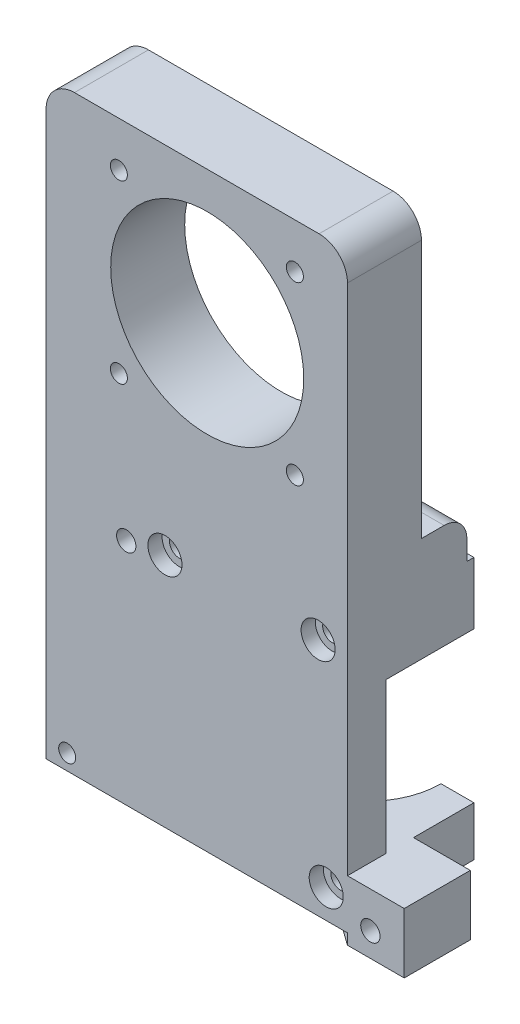
from build123d import *
from OCP.BRepAlgoAPI import BRepAlgoAPI_Cut
from OCP.TopTools import TopTools_ListOfShape

# Parameters (mm, degrees)
SKETCH1_W                     = 45
SKETCH1_H                     = 45
BOSS_EXTRUDE1_DEPTH           = 35
SKETCH2_R                     = 13
CUT_EXTRUDE3_DEPTH            = 35
SKETCH4_R                     = 1.7
CUT_EXTRUDE8_DEPTH            = 35
SKETCH7_R                     = 1.7
CUT_EXTRUDE9_DEPTH            = 35
SKETCH6_R                     = 1.7
CUT_EXTRUDE10_DEPTH           = 35
SKETCH5_R                     = 1.7
CUT_EXTRUDE11_DEPTH           = 35
CUT_EXTRUDE12_DEPTH           = 12
BOSS_EXTRUDE4_DEPTH           = 2
BOSS_EXTRUDE4_DEPTH_BACK      = 37.5
SKETCH14_W                    = 6
SKETCH14_H                    = 6
CUT_EXTRUDE17_START           = -7
SKETCH20_R                    = 2.2
CUT_EXTRUDE17_DEPTH           = 70.77141069
SKETCH21_R                    = 1.75
CUT_EXTRUDE18_DEPTH           = 2
BOSS_EXTRUDE5_DEPTH           = 44.571207257
BOSS_EXTRUDE5_DEPTH_BACK      = 1.562633388
SKETCH22_W                    = 53.082637552
SKETCH22_H                    = 40.002520942
SKETCH23_W                    = 29.449729346
SKETCH23_H                    = 26.517519529
CUT_EXTRUDE19_DEPTH           = 95.427299018
SKETCH25_R                    = 5
CUT_EXTRUDE24_DEPTH           = 2.6
SKETCH26_R                    = 8.1
CUT_EXTRUDE25_DEPTH           = 4
SKETCH27_R                    = 6.7
CUT_EXTRUDE28_DEPTH           = 6
SKETCH30_R                    = 13
CUT_EXTRUDE30_DEPTH           = 10.767560088
SKETCH31_W                    = 19.349450051
SKETCH31_H                    = 23.644133728
CUT_EXTRUDE31_DEPTH           = 9.664293754
SKETCH34_R                    = 1.5
CUT_EXTRUDE32_DEPTH           = 9
SKETCH37_W                    = 11.635024897
SKETCH37_H                    = 10.599921236
BOSS_EXTRUDE6_DEPTH           = 10
BOSS_EXTRUDE6_OTHER_WAY_DEPTH = 5
BOSS_EXTRUDE6_OTHER_WAY_TAPER = 29
SKETCH38_R                    = 1.700000001
CUT_EXTRUDE33_DEPTH           = 10
SKETCH39_R                    = 1.700000001
CUT_EXTRUDE34_DEPTH           = 88.0662855
SKETCH40_W                    = 17.159872711
SKETCH40_H                    = 13
BOSS_EXTRUDE7_DEPTH           = 16
SKETCH41_R                    = 4.5
CUT_EXTRUDE35_DEPTH           = 15
SKETCH42_W                    = 9.331425876
SKETCH42_H                    = 3
CUT_EXTRUDE36_DEPTH           = 15
CUT_EXTRUDE37_DEPTH           = 5
SKETCH44_R                    = 1.7
CUT_EXTRUDE38_DEPTH           = 23
CUT_EXTRUDE39_DEPTH           = 5
CUT_EXTRUDE40_DEPTH           = 5
CUT_EXTRUDE41_DEPTH           = 5
SKETCH53_R                    = 1.7
CUT_EXTRUDE42_DEPTH           = 90.646740997
SKETCH52_R                    = 1.7
CUT_EXTRUDE43_DEPTH           = 90.646740997
SKETCH51_R                    = 1.7
CUT_EXTRUDE44_DEPTH           = 90.646740997
CUT_EXTRUDE46_DEPTH           = 5
SKETCH57_R                    = 3
CUT_EXTRUDE48_DEPTH           = 2.5
SKETCH58_R                    = 3
CUT_EXTRUDE49_DEPTH           = 2.5
SKETCH59_R                    = 3
CUT_EXTRUDE50_DEPTH           = 2.5
SKETCH60_R                    = 3
CUT_EXTRUDE51_DEPTH           = 1
SKETCH61_W                    = 6.542017971
SKETCH61_H                    = 14.030300317
CUT_EXTRUDE52_DEPTH           = 6.5
SKETCH67_W                    = 5.604230097
SKETCH67_H                    = 8.996545788
BOSS_EXTRUDE8_DEPTH           = 33
SKETCH68_W                    = 5.604230097
SKETCH68_H                    = 9.400155495
BOSS_EXTRUDE9_DEPTH           = 33
SKETCH63_R                    = 1.7
CUT_EXTRUDE55_DEPTH           = 102.92049818
SKETCH62_R                    = 1.7
CUT_EXTRUDE56_DEPTH           = 102.92049818
SKETCH69_R                    = 3
CUT_EXTRUDE57_DEPTH           = 2.5
CUT_EXTRUDE58_DEPTH           = 2.5
SKETCH71_R                    = 3
CUT_EXTRUDE59_DEPTH           = 1
SKETCH73_R                    = 1.5
CUT_EXTRUDE61_DEPTH           = 5
SKETCH79_W                    = 95.658931194
SKETCH79_H                    = 51.290788201
CUT_EXTRUDE62_DEPTH           = 59
SKETCH80_W                    = 53.082637552
SKETCH80_H                    = 13.031868173
BOSS_EXTRUDE10_DEPTH          = 58
FILLET1_R                     = 5
SKETCH84_R                    = 17
CUT_EXTRUDE63_DEPTH           = 22
SKETCH85_R                    = 1.5
CUT_EXTRUDE64_DEPTH           = 15
SKETCH86_W                    = 15
SKETCH86_H                    = 8
BOSS_EXTRUDE11_DEPTH          = 7.5
BOSS_EXTRUDE12_START          = -29
BOSS_EXTRUDE12_DEPTH          = 15.917362448
BOSS_EXTRUDE12_START_2        = 15
BOSS_EXTRUDE12_2_OUTLINE_W    = 7.5
BOSS_EXTRUDE12_2_OUTLINE_H    = 8
BOSS_EXTRUDE12_2_DEPTH        = 10
BOSS_EXTRUDE13_DEPTH          = 15
BOSS_EXTRUDE13_START          = 15
BOSS_EXTRUDE13_2_DEPTH        = 10
SKETCH93_R                    = 7.627151398
CUT_EXTRUDE66_DEPTH           = 49.5
CUT_EXTRUDE67_DEPTH           = 53.5
SKETCH95_R                    = 7.676402713
CUT_EXTRUDE68_DEPTH           = 25.2
CUT_EXTRUDE69_DEPTH           = 34.5
CUT_EXTRUDE70_DEPTH           = 97.513539563
CUT_EXTRUDE70_DEPTH_BACK      = 97.513539563
SKETCH98_W                    = 8.013106882
SKETCH98_H                    = 5.054927498
SKETCH99_W                    = 2.898184018
SKETCH99_H                    = 3.4444183
CUT_EXTRUDE71_DEPTH           = 49.5
CUT_EXTRUDE75_DEPTH           = 2.8
CUT_EXTRUDE76_DEPTH           = 7.8
CUT_EXTRUDE77_START           = -2.8
CUT_EXTRUDE77_DEPTH           = 3.8
CUT_EXTRUDE77_START_2         = 24.96280414
CUT_EXTRUDE77_2_DEPTH         = 2.03719586
CUT_EXTRUDE78_DEPTH           = 7.8
SKETCH109_W                   = 3.474802874
SKETCH109_H                   = 1.768914447
SKETCH116_W                   = 11.383905976
SKETCH116_H                   = 17.385394655
CUT_EXTRUDE80_DEPTH           = 64
CUT_EXTRUDE81_DEPTH           = 1
SKETCH118_W                   = 155.245855906
SKETCH118_H                   = 137.927622152
CUT_EXTRUDE82_DEPTH           = 62


with BuildPart() as part:
    # Sketch1 → Boss-Extrude1 (new body)
    with BuildSketch(Plane.XY):
        Rectangle(SKETCH1_W, SKETCH1_H)
    extrude(amount=BOSS_EXTRUDE1_DEPTH)

    # Sketch2 → Cut-Extrude3 (cut)
    with BuildSketch(Plane.XY.offset(35)):
        Circle(SKETCH2_R)
    extrude(amount=-CUT_EXTRUDE3_DEPTH, mode=Mode.SUBTRACT)

    # Sketch4 → Cut-Extrude8 (cut)
    with BuildSketch(Plane(origin=(0, 0, 0), x_dir=(-1, 0, 0), z_dir=(0, 0, -1))):
        with Locations((-15.808862622, 15.928817575)):
            Circle(SKETCH4_R)
    extrude(amount=-CUT_EXTRUDE8_DEPTH, mode=Mode.SUBTRACT)

    # Sketch7 → Cut-Extrude9 (cut)
    with BuildSketch(Plane(origin=(0, 0, 0), x_dir=(-1, 0, 0), z_dir=(0, 0, -1))):
        with Locations((15.199970606, 15.923392722)):
            Circle(SKETCH7_R)
    extrude(amount=-CUT_EXTRUDE9_DEPTH, mode=Mode.SUBTRACT)

    # Sketch6 → Cut-Extrude10 (cut)
    with BuildSketch(Plane(origin=(0, 0, 0), x_dir=(-1, 0, 0), z_dir=(0, 0, -1))):
        with Locations((15.22029943, -15.065721832)):
            Circle(SKETCH6_R)
    extrude(amount=-CUT_EXTRUDE10_DEPTH, mode=Mode.SUBTRACT)

    # Sketch5 → Cut-Extrude11 (cut)
    with BuildSketch(Plane(origin=(0, 0, 0), x_dir=(-1, 0, 0), z_dir=(0, 0, -1))):
        with Locations((-15.781319068, -15.06525873)):
            Circle(SKETCH5_R)
    extrude(amount=-CUT_EXTRUDE11_DEPTH, mode=Mode.SUBTRACT)

    # Sketch8 → Cut-Extrude12 (cut)
    with BuildSketch(Plane(origin=(22.5, 0, 0), x_dir=(0, 0, -1), z_dir=(1, 0, 0))):
        Polygon((-4.363915061, -12.036124724), (-35, -12.036124724), (-35, 22.5), (-8.423058519, 22.5), (-8.423058519, 12.925541512), (-4.363915061, 12.925541512), align=None)
    extrude(amount=-CUT_EXTRUDE12_DEPTH, mode=Mode.SUBTRACT)

    # Sketch14 → Boss-Extrude4 (add, two sides: drawn at the far end of the back side and taken through both)
    with BuildSketch(Plane(origin=(0, 22.5, 0), x_dir=(1, 0, 0), z_dir=(0, 1, 0)).offset(-BOSS_EXTRUDE4_DEPTH_BACK)):
        with Locations((6.190916669, -17.729312446)):
            Rectangle(SKETCH14_W, SKETCH14_H)
    extrude(amount=BOSS_EXTRUDE4_DEPTH + BOSS_EXTRUDE4_DEPTH_BACK)

    # Sketch20 → Cut-Extrude17 (cut)
    with BuildSketch(Plane(origin=(0, 24.5, 0), x_dir=(1, 0, 0), z_dir=(0, 1, 0)).offset(CUT_EXTRUDE17_START)):
        with Locations(Location((6.190916669, -17.729312446, 0), (0, 0, 90))):
            Circle(SKETCH20_R)
    cut_extrude17 = extrude(amount=CUT_EXTRUDE17_DEPTH, mode=Mode.SUBTRACT)

    # Sketch21 → Cut-Extrude18 (cut)
    with BuildSketch(Plane(origin=(0, 17.5, 0), x_dir=(1, 0, 0), z_dir=(0, 1, 0))):
        with Locations(Location((6.190916669, -17.729312446, 0), (0, 0, 270))):
            Circle(SKETCH21_R)
    extrude(amount=-CUT_EXTRUDE18_DEPTH, mode=Mode.SUBTRACT)

    # Mirror6: Cut-Extrude17 across plane
    add(cut_extrude17.mirror(Plane.ZX.offset(16.5)), mode=Mode.SUBTRACT)

    # Sketch22 → Boss-Extrude5 (add, two sides: drawn at the far end of the back side and taken through both)
    with BuildSketch(Plane.XZ.offset(22.5).offset(-BOSS_EXTRUDE5_DEPTH_BACK)):
        with Locations((-1.541318776, 20.001258793)):
            Rectangle(SKETCH22_W, SKETCH22_H)
    extrude(amount=BOSS_EXTRUDE5_DEPTH + BOSS_EXTRUDE5_DEPTH_BACK)

    # Sketch23 → Cut-Extrude19 (cut, through all)
    with BuildSketch(Plane.ZY.offset(28.082637552)):
        with Locations((18.529138975, -45.100264067)):
            Rectangle(SKETCH23_W, SKETCH23_H)
    extrude(amount=-CUT_EXTRUDE19_DEPTH, mode=Mode.SUBTRACT)

    # Sketch25 → Cut-Extrude24 (cut)
    with BuildSketch(Plane(origin=(0, -20.937366612, 0), x_dir=(1, 0, 0), z_dir=(0, 1, 0))):
        with Locations(Location((6.190916669, -17.729312446, 0), (0, 0, 270))):
            Circle(SKETCH25_R)
    extrude(amount=-CUT_EXTRUDE24_DEPTH, mode=Mode.SUBTRACT)

    # Sketch26 → Cut-Extrude25 (cut)
    with BuildSketch(Plane(origin=(0, -23.537366612, 0), x_dir=(1, 0, 0), z_dir=(0, 1, 0))):
        with Locations(Location((6.190916669, -17.729312446, 0), (0, 0, 270))):
            Circle(SKETCH26_R)
    extrude(amount=-CUT_EXTRUDE25_DEPTH, mode=Mode.SUBTRACT)

    # Sketch27 → Cut-Extrude28 (cut)
    with BuildSketch(Plane(origin=(0, -27.537366612, 0), x_dir=(1, 0, 0), z_dir=(0, 1, 0))):
        with Locations(Location((6.190916669, -17.729312446, 0), (0, 0, 270))):
            Circle(SKETCH27_R)
    extrude(amount=-CUT_EXTRUDE28_DEPTH, mode=Mode.SUBTRACT)

    # Sketch30 → Cut-Extrude30 (cut)
    with BuildSketch(Plane(origin=(0, -58.359023831, 0), x_dir=(1, 0, 0), z_dir=(0, 1, 0))):
        with Locations(Location((6.207851035, -17.729312446, 0), (0, 0, 270))):
            Circle(SKETCH30_R)
    extrude(amount=-CUT_EXTRUDE30_DEPTH, mode=Mode.SUBTRACT)

    # Sketch31 → Cut-Extrude31 (cut)
    with BuildSketch(Plane.XZ.offset(67.071207257)):
        with Locations((-7.592166715, 17.462222744)):
            Rectangle(SKETCH31_W, SKETCH31_H)
    extrude(amount=-CUT_EXTRUDE31_DEPTH, mode=Mode.SUBTRACT)

    # Sketch34 → Cut-Extrude32 (cut)
    with BuildSketch(Plane.ZY.offset(28.082637552)):
        with Locations((35.530918006, -28.494957131)):
            Circle(SKETCH34_R)
        with Locations((3.530918006, -28.494957131)):
            Circle(SKETCH34_R)
        with Locations((35.530918006, -60.494957131)):
            Circle(SKETCH34_R)
        with Locations((3.530918006, -60.494957131)):
            Circle(SKETCH34_R)
    extrude(amount=-CUT_EXTRUDE32_DEPTH, mode=Mode.SUBTRACT)

    # Sketch37 → Boss-Extrude6 (add)
    with BuildSketch(Plane(origin=(25, 0, 0), x_dir=(0, 0, -1), z_dir=(1, 0, 0))):
        with Locations((-34.185004037, -63.658986353)):
            Rectangle(SKETCH37_W, SKETCH37_H)
    extrude(amount=BOSS_EXTRUDE6_DEPTH)

    # Sketch37 → Boss-Extrude6 other way (add)
    with BuildSketch(Plane(origin=(25, 0, 0), x_dir=(0, 0, -1), z_dir=(1, 0, 0))):
        with Locations((-34.185004037, -63.658986353)):
            Rectangle(SKETCH37_W, SKETCH37_H)
    extrude(amount=-BOSS_EXTRUDE6_OTHER_WAY_DEPTH, taper=BOSS_EXTRUDE6_OTHER_WAY_TAPER)

    # Sketch38 → Cut-Extrude33 (cut)
    with BuildSketch(Plane.XY.offset(40.002519264)):
        with Locations((29.034907303, -64.748396147)):
            Circle(SKETCH38_R)
    extrude(amount=-CUT_EXTRUDE33_DEPTH, mode=Mode.SUBTRACT)

    # Sketch39 → Cut-Extrude34 (cut, through all)
    with BuildSketch(Plane.XY.offset(40.002519264)):
        with Locations((-13.965092697, -26.748396147)):
            Circle(SKETCH39_R)
    extrude(amount=-CUT_EXTRUDE34_DEPTH, mode=Mode.SUBTRACT)

    # Sketch40 → Boss-Extrude7 (add)
    with BuildSketch(Plane(origin=(25, 0, 0), x_dir=(0, 0, -1), z_dir=(1, 0, 0))):
        with Locations((-8.579933523, -60.571207257)):
            Rectangle(SKETCH40_W, SKETCH40_H)
    extrude(amount=BOSS_EXTRUDE7_DEPTH)

    # Sketch41 → Cut-Extrude35 (cut)
    with BuildSketch(Plane(origin=(0, -54.071207257, 1.269334023), x_dir=(1, 0, 0), z_dir=(0, 1, 0))):
        with Locations(Location((31.163890056, -7.793414205, 0), (0, 0, 270))):
            Circle(SKETCH41_R)
    extrude(amount=-CUT_EXTRUDE35_DEPTH, mode=Mode.SUBTRACT)

    # Sketch42 → Cut-Extrude36 (cut)
    with BuildSketch(Plane(origin=(0, -54.071207257, 0), x_dir=(1, 0, 0), z_dir=(0, 1, 0))):
        with Locations((38.19390682, -9.095710432)):
            Rectangle(SKETCH42_W, SKETCH42_H)
    extrude(amount=-CUT_EXTRUDE36_DEPTH, mode=Mode.SUBTRACT)


with BuildPart() as cut_extrude37_tool:
    # Sketch43 → Cut-Extrude37 (new body)
    with BuildSketch(Plane(origin=(0, 0, 0), x_dir=(-1, 0, 0), z_dir=(0, 0, -1))):
        Polygon((-34.628927379, -64.403909926), (-32.738460245, -61.095415705), (-34.658466721, -57.80397603), (-38.468940333, -57.821030577), (-40.359407467, -61.129524799), (-38.439400991, -64.420964473), align=None)
    extrude(amount=-CUT_EXTRUDE37_DEPTH)


with BuildPart() as part_1:
    add(part.part)

    # Cut-Extrude37: cut by cut_extrude37_tool, with a tolerance
    cut_extrude37_stock = TopTools_ListOfShape()
    cut_extrude37_stock.Append(part_1.part.wrapped)
    cut_extrude37_tools = TopTools_ListOfShape()
    cut_extrude37_tools.Append(cut_extrude37_tool.part.wrapped)
    cut_extrude37_cut = BRepAlgoAPI_Cut()
    cut_extrude37_cut.SetArguments(cut_extrude37_stock)
    cut_extrude37_cut.SetTools(cut_extrude37_tools)
    cut_extrude37_cut.SetFuzzyValue(0.00001)
    cut_extrude37_cut.Build()
    add(Compound.cast(cut_extrude37_cut.Shape()).solids(), mode=Mode.REPLACE)

    # Sketch44 → Cut-Extrude38 (cut)
    with BuildSketch(Plane.XY.offset(17.159869878)):
        with Locations(Location((36.360549159, -61.087091915, 0), (0, 0, 123.670539257))):
            Circle(SKETCH44_R)
    extrude(amount=-CUT_EXTRUDE38_DEPTH, mode=Mode.SUBTRACT)


with BuildPart() as cut_extrude39_tool:
    # Sketch48 → Cut-Extrude39 (new body)
    with BuildSketch(Plane(origin=(0, 0, 0), x_dir=(-1, 0, 0), z_dir=(0, 0, -1))):
        Polygon((9.066729233, -28.811078933), (10.957196368, -25.502584711), (9.037189891, -22.211145037), (5.22671628, -22.228199584), (3.336249145, -25.536693806), (5.256255622, -28.82813348), align=None)
    extrude(amount=-CUT_EXTRUDE39_DEPTH)


with BuildPart() as part_2:
    add(part_1.part)

    # Cut-Extrude39: cut by cut_extrude39_tool, with a tolerance
    cut_extrude39_stock = TopTools_ListOfShape()
    cut_extrude39_stock.Append(part_2.part.wrapped)
    cut_extrude39_tools = TopTools_ListOfShape()
    cut_extrude39_tools.Append(cut_extrude39_tool.part.wrapped)
    cut_extrude39_cut = BRepAlgoAPI_Cut()
    cut_extrude39_cut.SetArguments(cut_extrude39_stock)
    cut_extrude39_cut.SetTools(cut_extrude39_tools)
    cut_extrude39_cut.SetFuzzyValue(0.00001)
    cut_extrude39_cut.Build()
    add(Compound.cast(cut_extrude39_cut.Shape()).solids(), mode=Mode.REPLACE)


with BuildPart() as cut_extrude40_tool:
    # Sketch49 → Cut-Extrude40 (new body)
    with BuildSketch(Plane(origin=(0, 0, 0), x_dir=(-1, 0, 0), z_dir=(0, 0, -1))):
        Polygon((-19.339505263, -65.26594849), (-17.449038128, -61.957454268), (-19.369044605, -58.666014594), (-23.179518216, -58.683069141), (-25.06998535, -61.991563363), (-23.149978874, -65.283003037), align=None)
    extrude(amount=-CUT_EXTRUDE40_DEPTH)


with BuildPart() as part_3:
    add(part_2.part)

    # Cut-Extrude40: cut by cut_extrude40_tool, with a tolerance
    cut_extrude40_stock = TopTools_ListOfShape()
    cut_extrude40_stock.Append(part_3.part.wrapped)
    cut_extrude40_tools = TopTools_ListOfShape()
    cut_extrude40_tools.Append(cut_extrude40_tool.part.wrapped)
    cut_extrude40_cut = BRepAlgoAPI_Cut()
    cut_extrude40_cut.SetArguments(cut_extrude40_stock)
    cut_extrude40_cut.SetTools(cut_extrude40_tools)
    cut_extrude40_cut.SetFuzzyValue(0.00001)
    cut_extrude40_cut.Build()
    add(Compound.cast(cut_extrude40_cut.Shape()).solids(), mode=Mode.REPLACE)


with BuildPart() as cut_extrude41_tool:
    # Sketch50 → Cut-Extrude41 (new body)
    with BuildSketch(Plane(origin=(0, 0, 0), x_dir=(-1, 0, 0), z_dir=(0, 0, -1))):
        Polygon((-17.911640095, -28.243498116), (-16.02117296, -24.935003895), (-17.941179437, -21.64356422), (-21.751653048, -21.660618767), (-23.642120183, -24.969112989), (-21.722113706, -28.260552663), align=None)
    extrude(amount=-CUT_EXTRUDE41_DEPTH)


with BuildPart() as part_4:
    add(part_3.part)

    # Cut-Extrude41: cut by cut_extrude41_tool, with a tolerance
    cut_extrude41_stock = TopTools_ListOfShape()
    cut_extrude41_stock.Append(part_4.part.wrapped)
    cut_extrude41_tools = TopTools_ListOfShape()
    cut_extrude41_tools.Append(cut_extrude41_tool.part.wrapped)
    cut_extrude41_cut = BRepAlgoAPI_Cut()
    cut_extrude41_cut.SetArguments(cut_extrude41_stock)
    cut_extrude41_cut.SetTools(cut_extrude41_tools)
    cut_extrude41_cut.SetFuzzyValue(0.00001)
    cut_extrude41_cut.Build()
    add(Compound.cast(cut_extrude41_cut.Shape()).solids(), mode=Mode.REPLACE)

    # Sketch53 → Cut-Extrude42 (cut, through all)
    with BuildSketch(Plane.XY.offset(40.002519264)):
        with Locations((21.259511739, -61.974508816)):
            Circle(SKETCH53_R)
    extrude(amount=-CUT_EXTRUDE42_DEPTH, mode=Mode.SUBTRACT)

    # Sketch52 → Cut-Extrude43 (cut, through all)
    with BuildSketch(Plane.XY.offset(40.002519264)):
        with Locations((19.831646572, -24.952058442)):
            Circle(SKETCH52_R)
    extrude(amount=-CUT_EXTRUDE43_DEPTH, mode=Mode.SUBTRACT)

    # Sketch51 → Cut-Extrude44 (cut, through all)
    with BuildSketch(Plane.XY.offset(40.002519264)):
        with Locations((-7.146722757, -25.519639258)):
            Circle(SKETCH51_R)
    extrude(amount=-CUT_EXTRUDE44_DEPTH, mode=Mode.SUBTRACT)


with BuildPart() as cut_extrude46_tool:
    # Sketch55 → Cut-Extrude46 (new body)
    with BuildSketch(Plane(origin=(0, 0, 0), x_dir=(-1, 0, 0), z_dir=(0, 0, -1))):
        Polygon((16.745274795, -30.164507999), (18.313623392, -26.048743749), (15.533441294, -22.632631898), (11.1849106, -23.332284296), (9.616562003, -27.448048545), (12.396744101, -30.864160397), align=None)
    extrude(amount=-CUT_EXTRUDE46_DEPTH)


with BuildPart() as part_5:
    add(part_4.part)

    # Cut-Extrude46: cut by cut_extrude46_tool, with a tolerance
    cut_extrude46_stock = TopTools_ListOfShape()
    cut_extrude46_stock.Append(part_5.part.wrapped)
    cut_extrude46_tools = TopTools_ListOfShape()
    cut_extrude46_tools.Append(cut_extrude46_tool.part.wrapped)
    cut_extrude46_cut = BRepAlgoAPI_Cut()
    cut_extrude46_cut.SetArguments(cut_extrude46_stock)
    cut_extrude46_cut.SetTools(cut_extrude46_tools)
    cut_extrude46_cut.SetFuzzyValue(0.00001)
    cut_extrude46_cut.Build()
    add(Compound.cast(cut_extrude46_cut.Shape()).solids(), mode=Mode.REPLACE)

    # Sketch57 → Cut-Extrude48 (cut)
    with BuildSketch(Plane.XY.offset(40.002519264)):
        with Locations((-7.146722757, -25.519639258)):
            Circle(SKETCH57_R)
    extrude(amount=-CUT_EXTRUDE48_DEPTH, mode=Mode.SUBTRACT)

    # Sketch58 → Cut-Extrude49 (cut)
    with BuildSketch(Plane.XY.offset(40.002519264)):
        with Locations((19.831646572, -24.952058442)):
            Circle(SKETCH58_R)
    extrude(amount=-CUT_EXTRUDE49_DEPTH, mode=Mode.SUBTRACT)

    # Sketch59 → Cut-Extrude50 (cut)
    with BuildSketch(Plane.XY.offset(40.002519264)):
        with Locations((21.259511739, -61.974508816)):
            Circle(SKETCH59_R)
    extrude(amount=-CUT_EXTRUDE50_DEPTH, mode=Mode.SUBTRACT)

    # Sketch60 → Cut-Extrude51 (cut)
    with BuildSketch(Plane(origin=(0, 0, 0), x_dir=(-1, 0, 0), z_dir=(0, 0, -1))):
        with Locations((-15.808862622, 15.928817575)):
            Circle(SKETCH60_R)
        with Locations((15.199970606, 15.923392722)):
            Circle(SKETCH60_R)
        with Locations((-15.781319068, -15.06525873)):
            Circle(SKETCH60_R)
        with Locations((15.22029943, -15.065721832)):
            Circle(SKETCH60_R)
    extrude(amount=-CUT_EXTRUDE51_DEPTH, mode=Mode.SUBTRACT)

    # Sketch61 → Cut-Extrude52 (cut)
    with BuildSketch(Plane(origin=(9.190916669, 0, 0), x_dir=(0, 0, -1), z_dir=(1, 0, 0))):
        with Locations((-17.812553374, 0.202623489)):
            Rectangle(SKETCH61_W, SKETCH61_H)
    extrude(amount=-CUT_EXTRUDE52_DEPTH, mode=Mode.SUBTRACT)

    # Sketch67 → Boss-Extrude8 (add)
    with BuildSketch(Plane(origin=(-22.5, -2.468350024, 0), x_dir=(0, 0, 1), z_dir=(-1, 0, 0))):
        with Locations((29.51622543, -5.940778019)):
            Rectangle(SKETCH67_W, SKETCH67_H)
    extrude(amount=-BOSS_EXTRUDE8_DEPTH)

    # Sketch68 → Boss-Extrude9 (add)
    with BuildSketch(Plane(origin=(-22.5, -2.468350024, 0), x_dir=(0, 0, 1), z_dir=(-1, 0, 0))):
        with Locations((9.47264346, -5.966332429)):
            Rectangle(SKETCH68_W, SKETCH68_H)
    extrude(amount=-BOSS_EXTRUDE9_DEPTH)

    # Sketch63 → Cut-Extrude55 (cut, through all)
    with BuildSketch(Plane.ZY.offset(22.5)):
        with Locations(Location((29.516225429, -7.068802512, 0), (0, 0, 270))):
            Circle(SKETCH63_R)
    extrude(amount=-CUT_EXTRUDE55_DEPTH, mode=Mode.SUBTRACT)

    # Sketch62 → Cut-Extrude56 (cut, through all)
    with BuildSketch(Plane.ZY.offset(22.5)):
        with Locations(Location((9.403782955, -7.127149089, 0), (0, 0, 270))):
            Circle(SKETCH62_R)
    extrude(amount=-CUT_EXTRUDE56_DEPTH, mode=Mode.SUBTRACT)

    # Sketch69 → Cut-Extrude57 (cut)
    with BuildSketch(Plane.ZY.offset(22.5)):
        with Locations(Location((9.403782955, -7.127149089, 0), (0, 0, 270))):
            Circle(SKETCH69_R)
        with Locations(Location((29.516225429, -7.068802512, 0), (0, 0, 270))):
            Circle(SKETCH69_R)
    extrude(amount=-CUT_EXTRUDE57_DEPTH, mode=Mode.SUBTRACT)

    # Sketch70 → Cut-Extrude58 (cut)
    with BuildSketch(Plane(origin=(0, 0, 28.367491588), x_dir=(-1, 0, 0), z_dir=(0, 0, -1))):
        Polygon((-25.057295961, -66.811454801), (-25.259440428, -62.335213005), (-29.23705177, -60.272154352), (-33.012518645, -62.685337494), (-32.810374177, -67.161579289), (-28.832762835, -69.224637943), align=None)
    extrude(amount=-CUT_EXTRUDE58_DEPTH, mode=Mode.SUBTRACT)

    # Sketch71 → Cut-Extrude59 (cut)
    with BuildSketch(Plane.XY.offset(17.159869878)):
        with Locations((36.360549159, -61.087091915)):
            Circle(SKETCH71_R)
    extrude(amount=-CUT_EXTRUDE59_DEPTH, mode=Mode.SUBTRACT)

    # Sketch73 → Cut-Extrude61 (cut)
    with BuildSketch(Plane.XY.offset(40.002519264)):
        with Locations((-24.369276222, -64.32278971)):
            Circle(SKETCH73_R)
    extrude(amount=-CUT_EXTRUDE61_DEPTH, mode=Mode.SUBTRACT)

    # Sketch79 → Cut-Extrude62 (cut)
    with BuildSketch(Plane(origin=(0, -20.937366612, 0), x_dir=(1, 0, 0), z_dir=(0, 1, 0))):
        with Locations((-4.270574665, -23.740541644)):
            Rectangle(SKETCH79_W, SKETCH79_H)
    extrude(amount=CUT_EXTRUDE62_DEPTH, mode=Mode.SUBTRACT)

    # Sketch80 → Boss-Extrude10 (add)
    with BuildSketch(Plane(origin=(0, -20.937366612, 0), x_dir=(1, 0, 0), z_dir=(0, 1, 0))):
        with Locations((-1.541318776, -33.486585178)):
            Rectangle(SKETCH80_W, SKETCH80_H)
    extrude(amount=BOSS_EXTRUDE10_DEPTH)

    # Fillet1
    fillet1_edges = [part_5.edges().sort_by_distance(p)[0] for p in [
        (-28.082637552, 37.062633388, 33.486585177),
        (25, 37.062633388, 33.486585177),
    ]]
    fillet(fillet1_edges, radius=FILLET1_R)

    # Sketch84 → Cut-Extrude63 (cut)
    with BuildSketch(Plane(origin=(0, 0, 26.970651091), x_dir=(-1, 0, 0), z_dir=(0, 0, -1))):
        with Locations((-0.29898878, 13.603645853)):
            Circle(SKETCH84_R)
    extrude(amount=-CUT_EXTRUDE63_DEPTH, mode=Mode.SUBTRACT)

    # Sketch85 → Cut-Extrude64 (cut)
    with BuildSketch(Plane.XY.offset(40.002519264)):
        with Locations((15.736832887, 29.13557467)):
            Circle(SKETCH85_R)
        with Locations((15.736832887, -1.86442533)):
            Circle(SKETCH85_R)
        with Locations((-15.263167113, -1.86442533)):
            Circle(SKETCH85_R)
        with Locations((-15.263167113, 29.13557467)):
            Circle(SKETCH85_R)
    extrude(amount=-CUT_EXTRUDE64_DEPTH, mode=Mode.SUBTRACT)

    # Sketch86 → Boss-Extrude11 (add)
    with BuildSketch(Plane(origin=(0, -20.937366612, 0), x_dir=(1, 0, 0), z_dir=(0, 1, 0))):
        with Locations((-20.582637552, -22.970651091)):
            Rectangle(SKETCH86_W, SKETCH86_H)
    extrude(amount=BOSS_EXTRUDE11_DEPTH)

    # Boss-Extrude12: read off the stored shape, not the designer's step
    # Boss-Extrude12 outline → Boss-Extrude12 (cut)
    with BuildSketch(Plane.YZ.offset(BOSS_EXTRUDE12_START)):
        with BuildLine():
            Line((-16.437366612, 18.970651091), (-13.437366612, 18.970651091))
            Line((-13.437366612, 18.970651091), (-13.437366612, 21.970651091))
            ThreePointArc((-13.437366612, 21.970651091), (-14.316046269, 19.849330747), (-16.437366612, 18.970651091))
        make_face()
    extrude(amount=BOSS_EXTRUDE12_DEPTH, mode=Mode.SUBTRACT)

    # Boss-Extrude12 2 outline → Boss-Extrude12 2 (add)
    with BuildSketch(Plane.YZ.offset(BOSS_EXTRUDE12_START_2)):
        with Locations((-17.187366612, 22.970651091)):
            Rectangle(BOSS_EXTRUDE12_2_OUTLINE_W, BOSS_EXTRUDE12_2_OUTLINE_H)
    extrude(amount=BOSS_EXTRUDE12_2_DEPTH)

    # Boss-Extrude13: read off the stored shape, not the designer's step
    # Boss-Extrude13 outline → Boss-Extrude13 (add)
    with BuildSketch(Plane(origin=(0, 0, 0), x_dir=(-1, 0, 0), z_dir=(0, 0, -1))):
        Polygon((-23.36274568, -48.619339256), (-23.367757646, -50.680300201), (-17.462746069, -50.680300201), (-17.462746069, -67.863551646), (-14.177545807, -71.190127808), (14.249697088, -71.190127808), (17.037255803, -68.36197067), (17.037255803, -50.689145022), (26.017272956, -50.689145022), (26.017272956, -40.681920979), (25.993659225, -36.474000388), (25.993659225, 10.373411619), (17.549011758, 18.922680584), (9.039575962, 18.922680584), (9.039575962, 7.780578291), (2.010790556, 7.780578291), (2.041381355, 18.922680584), (-6.46274534, 18.922680584), (-6.46274534, 3.355731571), (-21.962746009, 3.324374492), (-25.955095041, -0.667921289), (-25.955095041, -40.308078249), (-23.36274568, -40.308078249), align=None)
    extrude(amount=BOSS_EXTRUDE13_DEPTH)

    # Boss-Extrude13 2 outline → Boss-Extrude13 2 (cut)
    with BuildSketch(Plane.YZ.offset(BOSS_EXTRUDE13_START)):
        with BuildLine():
            Line((-13.437366612, 18.970651091), (-13.437366612, 22.970651091))
            ThreePointArc((-13.437366612, 22.970651091), (-14.608939488, 20.142223966), (-17.437366612, 18.970651091))
            Line((-17.437366612, 18.970651091), (-13.437366612, 18.970651091))
        make_face()
    extrude(amount=BOSS_EXTRUDE13_2_DEPTH, mode=Mode.SUBTRACT)

    # Sketch93 → Cut-Extrude66 (cut)
    with BuildSketch(Plane(origin=(24.955095041, 0, 0), x_dir=(0, 0, -1), z_dir=(1, 0, 0))):
        with Locations((12.256212071, -11.171428731)):
            Circle(SKETCH93_R)
    extrude(amount=-CUT_EXTRUDE66_DEPTH, mode=Mode.SUBTRACT)

    # Sketch94 → Cut-Extrude67 (cut)
    with BuildSketch(Plane(origin=(25.955095041, 0, 0), x_dir=(0, 0, -1), z_dir=(1, 0, 0))):
        with BuildLine():
            Line((7.304469319, -5.317971055), (7.304469319, -17.0155586))
            ThreePointArc((7.304469319, -17.0155586), (9.618622803, -18.361450318), (12.254533613, -18.82910945))
            Line((12.254533613, -18.82910945), (12.247539174, -19.175326281))
            Line((12.247539174, -19.175326281), (15.247498718, -19.190821279))
            Line((15.247498718, -19.190821279), (15.247498718, -18.220394035))
            ThreePointArc((15.247498718, -18.220394035), (19.890575189, -11.801110292), (16.37036652, -4.703681616))
            Line((16.37036652, -4.703681616), (16.37036652, -3.504420205))
            Line((16.37036652, -3.504420205), (12.254533613, -3.504420205))
            ThreePointArc((12.254533613, -3.504420205), (9.618622803, -3.972079337), (7.304469319, -5.317971055))
        make_face()
    extrude(amount=-CUT_EXTRUDE67_DEPTH, mode=Mode.SUBTRACT)

    # Sketch95 → Cut-Extrude68 (cut)
    with BuildSketch(Plane(origin=(12.462746069, 0, 0), x_dir=(0, 0, -1), z_dir=(1, 0, 0))):
        with Locations((12.092444965, -56.175071744)):
            Circle(SKETCH95_R)
    extrude(amount=-CUT_EXTRUDE68_DEPTH, mode=Mode.SUBTRACT)


with BuildPart() as cut_extrude69_tool:
    # Sketch96 → Cut-Extrude69 (new body)
    with BuildSketch(Plane(origin=(17.462746069, 0, 0), x_dir=(0, 0, -1), z_dir=(1, 0, 0))):
        with BuildLine():
            Line((7.026567917, -61.944543955), (7.093866549, -50.680300201))
            Line((7.093866549, -50.680300201), (18.039621023, -50.680300201))
            ThreePointArc((18.039621023, -50.680300201), (19.821216346, -57.783077051), (15, -63.294827572))
            Line((15, -63.294827572), (15, -64.164154351))
            Line((15, -64.164154351), (12.017415984, -64.164154351))
            Line((12.017415984, -64.164154351), (12.017415984, -63.827835882))
            ThreePointArc((12.017415984, -63.827835882), (9.358123262, -63.320452774), (7.026567917, -61.944543955))
        make_face()
    extrude(amount=-CUT_EXTRUDE69_DEPTH)


with BuildPart() as part_6:
    add(part_5.part)

    # Cut-Extrude69: cut by cut_extrude69_tool, with a tolerance
    cut_extrude69_stock = TopTools_ListOfShape()
    cut_extrude69_stock.Append(part_6.part.wrapped)
    cut_extrude69_tools = TopTools_ListOfShape()
    cut_extrude69_tools.Append(cut_extrude69_tool.part.wrapped)
    cut_extrude69_cut = BRepAlgoAPI_Cut()
    cut_extrude69_cut.SetArguments(cut_extrude69_stock)
    cut_extrude69_cut.SetTools(cut_extrude69_tools)
    cut_extrude69_cut.SetFuzzyValue(0.00001)
    cut_extrude69_cut.Build()
    add(Compound.cast(cut_extrude69_cut.Shape()).solids(), mode=Mode.REPLACE)

    # Sketch98 → Cut-Extrude70 (cut, two sides: drawn at the far end of the back side and taken through both)
    with BuildSketch(Plane(origin=(23.36274568, 0, 0), x_dir=(0, 0, -1), z_dir=(1, 0, 0)).offset(-CUT_EXTRUDE70_DEPTH_BACK)):
        with Locations((11.116985965, -40.66303761)):
            Rectangle(SKETCH98_W, SKETCH98_H)
    extrude(amount=CUT_EXTRUDE70_DEPTH + CUT_EXTRUDE70_DEPTH_BACK, mode=Mode.SUBTRACT)

    # Sketch99 → Cut-Extrude71 (cut)
    with BuildSketch(Plane(origin=(23.36274568, 0, 0), x_dir=(0, 0, -1), z_dir=(1, 0, 0))):
        with Locations((13.550907991, -46.897130106)):
            Rectangle(SKETCH99_W, SKETCH99_H)
    extrude(amount=-CUT_EXTRUDE71_DEPTH, mode=Mode.SUBTRACT)

    # Sketch104 → Cut-Extrude75 (cut)
    with BuildSketch(Plane(origin=(0, 0, -15), x_dir=(-1, 0, 0), z_dir=(0, 0, -1))):
        Polygon((-25.962747095, -29.314686028), (-24.96280414, -29.314686028), (-24.962745068, -30.066577416), (-23.962746767, -30.066577416), (-23.962555313, -29.299441116), (-22.961420056, -29.299441116), (-22.962748465, -30.066577416), (-21.962746439, -30.066577416), (-21.962746439, -29.314686028), (-20.962748138, -29.314686028), (-20.962748138, -30.066577416), (-19.962746111, -30.066577416), (-19.962746111, -29.299986228), (-19.144147096, -28.918292488), (-18.826346306, -29.599683698), (-17.920043275, -29.177095608), (-18.237847297, -28.495596886), (-17.33154498, -28.073009129), (-17.013747421, -28.754493991), (-16.107448591, -28.33179631), (-16.425247698, -27.650408709), (-15.518847316, -27.227813689), (-15.201147108, -27.9092049), (-14.294844791, -27.486617142), (-14.552147522, -26.934719209), (-13.762747332, -26.934719209), (-13.762747332, -27.686608735), (-12.762747168, -27.686608735), (-12.758801937, -26.913738568), (-11.762747004, -26.934719209), (-11.762747004, -27.686608735), (-10.76274684, -27.686608735), (-10.76274684, -26.934719209), (-9.762746677, -26.934719209), (-9.762746677, -27.686608735), (-8.762746512, -27.686608735), (-8.762746512, -26.934719209), (-7.762746349, -26.934719209), (-7.762746349, -27.686608735), (-6.854745954, -27.686608735), (-6.836747215, -25.281740545), (-6.838062023, -25.283268804), (-15.295775537, -25.339216406), (-20.3314935, -27.686608735), (-25.955095041, -27.686608735), align=None)
    extrude(amount=-CUT_EXTRUDE75_DEPTH, mode=Mode.SUBTRACT)

    # Sketch100 → Cut-Extrude76 (cut)
    with BuildSketch(Plane(origin=(0, 0, -15), x_dir=(-1, 0, 0), z_dir=(0, 0, -1))):
        Polygon((-25.955095041, -28.945247979), (-24.96280414, -28.945247979), (-24.96280414, -29.653634253), (-23.962555313, -29.653634253), (-23.962555313, -28.945247979), (-22.96424876, -28.945247979), (-22.958591351, -29.653634253), (-21.96304054, -29.653634253), (-21.96304054, -28.945247979), (-20.964934987, -28.945247979), (-20.959285676, -29.652620306), (-19.966016734, -29.644687729), (-19.972347716, -28.851960783), (-19.311248099, -28.543611164), (-19.008595517, -29.192496369), (-18.101434673, -28.769379045), (-18.404087256, -28.120493839), (-17.504286227, -27.700809274), (-17.201633644, -28.34969448), (-16.290191613, -27.924580327), (-16.592844196, -27.275695121), (-15.694477438, -26.856679528), (-15.219820827, -27.874340274), (-14.310167076, -27.450060209), (-14.728288096, -26.553611409), (-13.753525037, -26.553611409), (-13.753525037, -27.273865726), (-12.758801937, -27.273865726), (-12.758801937, -26.553611409), (-11.754470509, -26.553611409), (-11.754470509, -27.273865726), (-10.75686259, -27.273865726), (-10.75686259, -26.553611409), (-9.753121992, -26.553611409), (-9.753121992, -27.273865726), (-8.756088304, -27.273865726), (-8.756088304, -26.553611409), (-7.751750339, -26.553611409), (-7.751750339, -27.273865726), (-7.458768632, -27.273865726), (-6.712940952, -27.776466421), (-6.455012931, -27.900295376), (-6.808295478, -25.767524786), (-15.079976742, -25.767524786), (-20.197235679, -28.15997504), (-25.955095041, -28.199343388), align=None)
    extrude(amount=-CUT_EXTRUDE76_DEPTH, mode=Mode.SUBTRACT)

    # Cut-Extrude77: read off the stored shape, not the designer's step
    # Cut-Extrude77 outline → Cut-Extrude77 (cut)
    with BuildSketch(Plane(origin=(0, 0, -15), x_dir=(-1, 0, 0), z_dir=(0, 0, -1)).offset(CUT_EXTRUDE77_START)):
        Polygon((25.037253816, -32.066549204), (25.037253816, -31.307907657), (25.993659225, -31.314365331), (25.993659225, -30.182050347), (20.166533002, -30.182050347), (11.585187457, -25.26675256), (8.223678341, -25.225537355), (7.936525965, -27.116615257), (8.687253647, -27.116615257), (8.687253647, -26.364725731), (9.687253345, -26.364725731), (9.687253345, -27.116615257), (10.687253509, -27.116615257), (10.687253509, -26.364725731), (11.300593219, -26.364725731), (11.504443433, -26.482424708), (11.128503435, -27.133516674), (11.994533312, -27.633509155), (12.370473311, -26.98241719), (13.23649666, -27.482405902), (12.860554217, -28.133502102), (13.726584095, -28.633494583), (14.102523287, -27.982404015), (14.968546637, -28.482392727), (14.592604194, -29.133488927), (15.458634159, -29.633481459), (15.83457287, -28.982391722), (16.70059837, -29.482381676), (16.324657404, -30.133475318), (17.190685132, -30.633466558), (17.566623356, -29.982377665), (18.432646619, -30.482366327), (18.05670665, -31.133458242), (18.922736702, -31.633450824), (19.298673448, -30.98236449), (20.037253462, -31.408759256), (20.037253462, -32.066549204), (21.03725316, -32.066549204), (21.03725316, -31.314659678), (22.037253324, -31.314659678), (22.037253324, -32.066549204), (23.037253488, -32.066549204), (23.037253488, -31.314659678), (24.037253186, -31.314659678), (24.037253186, -32.066549204), align=None)
    extrude(amount=CUT_EXTRUDE77_DEPTH, mode=Mode.SUBTRACT)

    # Cut-Extrude77 2 outline → Cut-Extrude77 2 (cut)
    with BuildSketch(Plane.YZ.offset(CUT_EXTRUDE77_START_2)):
        with BuildLine():
            Line((-28.945247979, -12.2), (-28.945247979, -9.506994896))
            ThreePointArc((-28.945247979, -9.506994896), (-29.038037991, -10.866108666), (-29.314686028, -12.2))
            Line((-29.314686028, -12.2), (-28.945247979, -12.2))
        make_face()
    extrude(amount=CUT_EXTRUDE77_2_DEPTH, mode=Mode.SUBTRACT)

    # Sketch108 → Cut-Extrude78 (cut)
    with BuildSketch(Plane(origin=(0, 0, -15), x_dir=(-1, 0, 0), z_dir=(0, 0, -1))):
        Polygon((8.226439423, -26.699867267), (8.658716653, -26.732210962), (8.658716653, -25.962704734), (9.664352311, -25.962704734), (9.687253345, -26.699401718), (10.687253509, -26.699401718), (10.687253509, -25.962704734), (11.404382143, -25.962704734), (11.706675461, -26.117537897), (11.360435825, -26.793529567), (12.182503311, -27.307963172), (12.558809802, -26.656236477), (13.409910595, -27.147661418), (13.048525439, -27.807954002), (13.914553691, -28.307949299), (14.302417941, -27.636140183), (15.163884185, -28.133501637), (14.780573386, -28.80794341), (15.64658102, -29.307975549), (16.037904671, -28.630240574), (16.903451672, -29.130006745), (16.512627887, -29.807928497), (17.336177211, -30.282706984), (17.751550635, -29.618938167), (18.625090615, -30.122536407), (18.256107931, -30.773265697), (19.110665426, -31.266638434), (19.484994425, -30.618273358), (20.046502181, -30.942455896), (20.044424464, -31.649335664), (21.03725316, -31.649335664), (21.03725316, -30.896614279), (22.038752496, -30.896614279), (22.037253324, -31.649335664), (23.037253488, -31.649335664), (23.037253488, -30.896614279), (24.031061878, -30.896614279), (24.037253186, -31.649335664), (25.037253816, -31.649335664), (25.037253816, -30.896614279), (26.037253887, -30.912138111), (25.993659225, -29.661682877), (20.084292403, -29.661682877), (11.510643246, -24.711747068), (7.735310008, -24.675249023), align=None)
    extrude(amount=-CUT_EXTRUDE78_DEPTH, mode=Mode.SUBTRACT)

    # Cut-Sweep2: sweep along a path in Sketch111
    with BuildLine(Plane.ZY.offset(20.993659225)) as cut_sweep2_path:
        CenterArc((-11.50693286, -11.111866598), 9.973751919, 0, 360)
    # Sketch109 → Cut-Sweep2 (sweep, cut)
    with BuildSketch(Plane(origin=(0, 0, -15), x_dir=(-1, 0, 0), z_dir=(0, 0, -1))):
        with Locations((21.04243553, -1.343740229)):
            Rectangle(SKETCH109_W, SKETCH109_H)
    sweep(path=cut_sweep2_path.line, mode=Mode.SUBTRACT)

    # Cut-Extrude79: read off the stored shape, not the designer's step
    # Cut-Extrude79: loft between two sections, ruled curve by curve
    cut_extrude79_from = [
        Edge.make_three_point_arc((17.180563719, -2.228855966, -15), (17.180563719, -4.180492922, -7.501667083), (17.180563719, -11.194855704, -4.210375833)),
        Edge.make_three_point_arc((17.180563719, -11.194855704, -4.210375833), (17.180563719, -18.209218487, -7.501667083), (17.180563719, -20.160855443, -15)),
        Edge.make_three_point_arc((17.180563719, -0.421929492, -15), (17.180563719, -2.917070683, -6.236722824), (17.180563719, -11.194855704, -2.428963436)),
        Edge.make_three_point_arc((17.180563719, -11.194855704, -2.428963436), (17.180563719, -19.472640726, -6.236722824), (17.180563719, -21.967781917, -15)),
        Edge.make_line((17.180563719, -0.421929492, -15), (17.180563719, -2.228855966, -15)),
        Edge.make_line((17.180563719, -21.967781917, -15), (17.180563719, -20.160855443, -15)),
    ]
    cut_extrude79_to = [
        Edge.make_three_point_arc((20.73735583, -2.228855966, -15), (20.73735583, -4.180492922, -7.501667083), (20.73735583, -11.194855704, -4.210375833)),
        Edge.make_three_point_arc((20.73735583, -11.194855704, -4.210375833), (20.73735583, -18.209218487, -7.501667083), (20.73735583, -20.160855443, -15)),
        Edge.make_three_point_arc((20.73735583, -0.421929492, -15), (20.73735583, -2.917070683, -6.236722824), (20.73735583, -11.194855704, -2.428963436)),
        Edge.make_three_point_arc((20.73735583, -11.194855704, -2.428963436), (20.73735583, -19.472640726, -6.236722824), (20.73735583, -21.967781917, -15)),
        Edge.make_line((20.73735583, -0.421929492, -15), (20.73735583, -2.228855966, -15)),
        Edge.make_line((20.73735583, -21.967781917, -15), (20.73735583, -20.160855443, -15)),
    ]
    cut_extrude79 = Solid(Shell([*[Face.make_surface_from_curves(cut_extrude79_from[k], cut_extrude79_to[k]) for k in range(6)], Face(Wire(cut_extrude79_from)), Face(Wire(cut_extrude79_to))]))
    add(cut_extrude79, mode=Mode.SUBTRACT)

    # Cut-Extrude79 2: loft between two sections, ruled curve by curve
    cut_extrude79_2_from = [
        Edge.make_line((7.544895519, -0.163078289, -10.5), (7.544895519, 3.353542341, -10.5)),
        Edge.make_line((14.418603844, 3.339636573, -10.5), (14.418603844, -0.163078289, -10.5)),
        Edge.make_line((9.2633226, -3.139481303, -10.5), (7.544895519, -0.163078289, -10.5)),
        Edge.make_line((12.700176763, -3.139481303, -10.5), (9.2633226, -3.139481303, -10.5)),
        Edge.make_line((14.418603844, -0.163078289, -10.5), (12.700176763, -3.139481303, -10.5)),
        Edge.make_line((14.418603844, 3.339636573, -10.5), (7.544895519, 3.353542341, -10.5)),
    ]
    cut_extrude79_2_to = [
        Edge.make_line((7.544895519, -0.163078289, -8.5), (7.544895519, 3.353542341, -8.5)),
        Edge.make_line((14.418603844, 3.339636573, -8.5), (14.418603844, -0.163078289, -8.5)),
        Edge.make_line((9.2633226, -3.139481303, -8.5), (7.544895519, -0.163078289, -8.5)),
        Edge.make_line((12.700176763, -3.139481303, -8.5), (9.2633226, -3.139481303, -8.5)),
        Edge.make_line((14.418603844, -0.163078289, -8.5), (12.700176763, -3.139481303, -8.5)),
        Edge.make_line((14.418603844, 3.339636573, -8.5), (7.544895519, 3.353542341, -8.5)),
    ]
    cut_extrude79_2 = Solid(Shell([*[Face.make_surface_from_curves(cut_extrude79_2_from[k], cut_extrude79_2_to[k]) for k in range(6)], Face(Wire(cut_extrude79_2_from)), Face(Wire(cut_extrude79_2_to))]))
    add(cut_extrude79_2, mode=Mode.SUBTRACT)

    # Cut-Extrude79 3: loft between two sections, ruled curve by curve
    cut_extrude79_3_from = [
        Edge.make_line((-15.913131159, -0.163078289, -10.5), (-15.913131159, 4.395411301, -10.5)),
        Edge.make_line((-14.191827251, -3.144464114, -10.5), (-15.913131159, -0.163078289, -10.5)),
        Edge.make_line((-10.749219434, -3.144464114, -10.5), (-14.191827251, -3.144464114, -10.5)),
        Edge.make_line((-9.027915526, -0.163078289, -10.5), (-10.749219434, -3.144464114, -10.5)),
        Edge.make_line((-9.027915526, 4.050034744, -10.5), (-9.027915526, -0.163078289, -10.5)),
        Edge.make_line((-15.913131159, 4.395411301, -10.5), (-9.027915526, 4.050034744, -10.5)),
    ]
    cut_extrude79_3_to = [
        Edge.make_line((-15.913131159, -0.163078289, -8.5), (-15.913131159, 4.395411301, -8.5)),
        Edge.make_line((-14.191827251, -3.144464114, -8.5), (-15.913131159, -0.163078289, -8.5)),
        Edge.make_line((-10.749219434, -3.144464114, -8.5), (-14.191827251, -3.144464114, -8.5)),
        Edge.make_line((-9.027915526, -0.163078289, -8.5), (-10.749219434, -3.144464114, -8.5)),
        Edge.make_line((-9.027915526, 4.050034744, -8.5), (-9.027915526, -0.163078289, -8.5)),
        Edge.make_line((-15.913131159, 4.395411301, -8.5), (-9.027915526, 4.050034744, -8.5)),
    ]
    cut_extrude79_3 = Solid(Shell([*[Face.make_surface_from_curves(cut_extrude79_3_from[k], cut_extrude79_3_to[k]) for k in range(6)], Face(Wire(cut_extrude79_3_from)), Face(Wire(cut_extrude79_3_to))]))
    add(cut_extrude79_3, mode=Mode.SUBTRACT)

    # Sketch116 → Cut-Extrude80 (cut)
    with BuildSketch(Plane.ZY.offset(25.993659225)):
        with Locations((-14.055766201, 12.03773182)):
            Rectangle(SKETCH116_W, SKETCH116_H)
    extrude(amount=-CUT_EXTRUDE80_DEPTH, mode=Mode.SUBTRACT)

    # Sketch117 → Cut-Extrude81 (cut, symmetric)
    with BuildSketch(Plane(origin=(0, 0, -11.2), x_dir=(-1, 0, 0), z_dir=(0, 0, -1))):
        Polygon((-12.802402757, -67.141982284), (-12.802402757, -62.548577137), (-6.895710068, -62.548577137), (-7.028900065, -67.141982284), (-8.472275738, -69.641982284), (-11.359027084, -69.641982284), align=None)
        Polygon((11.458330412, -69.685420104), (12.901706085, -67.185420104), (12.901706085, -62.687540344), (7.128203393, -62.687540344), (7.128203393, -67.185420104), (8.571579066, -69.685420104), align=None)
    extrude(amount=CUT_EXTRUDE81_DEPTH, both=True, mode=Mode.SUBTRACT)

    # Sketch118 → Cut-Extrude82 (cut)
    with BuildSketch(Plane.XY.offset(17.729312446)):
        with Locations((6.664587045, -16.586469876)):
            Rectangle(SKETCH118_W, SKETCH118_H)
    extrude(amount=-CUT_EXTRUDE82_DEPTH, mode=Mode.SUBTRACT)


solid = part_6.part
